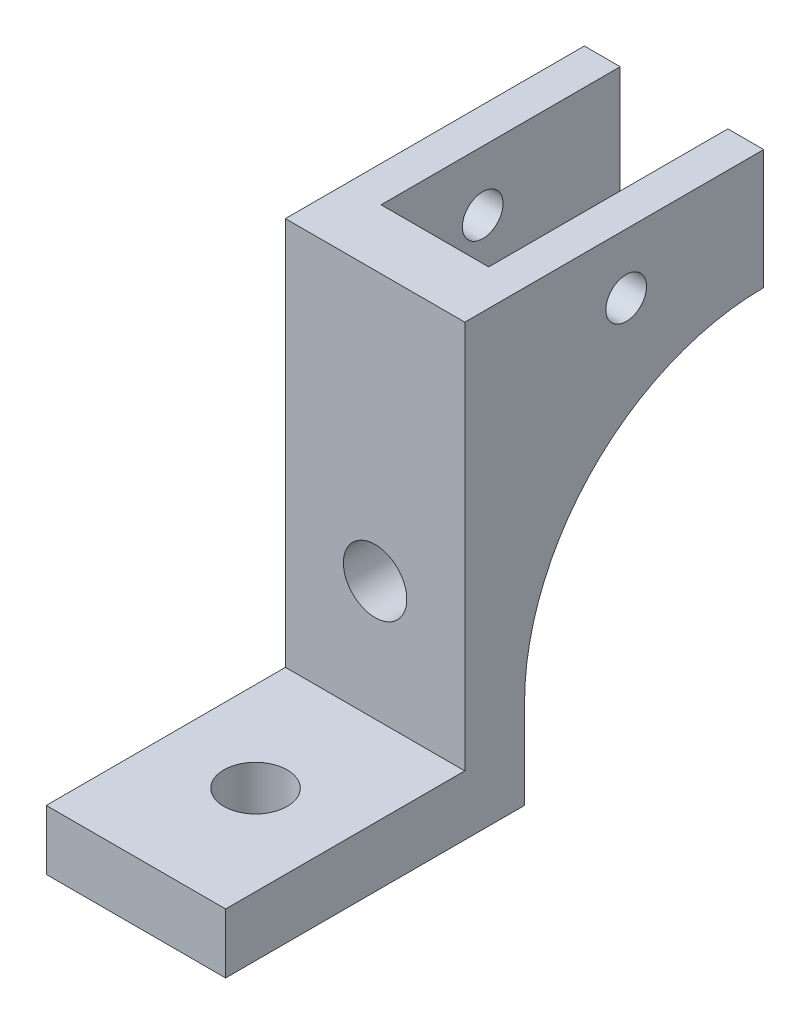
from build123d import *

# Parameters (mm, degrees)
SKETCH2_W               = 15
SKETCH2_H               = 37.5
BOSS_EXTRUDE1_DEPTH     = 5
SKETCH3_W               = 15
SKETCH3_H               = 5
BOSS_EXTRUDE2_DEPTH     = 20
SKETCH4_W               = 3
SKETCH4_H               = 10
BOSS_EXTRUDE3_DEPTH     = 20
CUT_EXTRUDE1_DEPTH      = 48.5
CUT_EXTRUDE1_DEPTH_BACK = 48.5
SKETCH5_R               = 1.7
FILLET1_R               = 20
SKETCH6_R               = 2.65
CUT_EXTRUDE2_DEPTH      = 10
SKETCH7_R               = 2.65
CUT_EXTRUDE3_DEPTH      = 10


with BuildPart() as part:
    # Sketch2 → Boss-Extrude1 (new body)
    with BuildSketch(Plane.XY):
        with Locations((7.5, 18.75)):
            Rectangle(SKETCH2_W, SKETCH2_H)
    extrude(amount=BOSS_EXTRUDE1_DEPTH)

    # Sketch3 → Boss-Extrude2 (add)
    with BuildSketch(Plane.XY.offset(5)):
        with Locations((7.5, 2.5)):
            Rectangle(SKETCH3_W, SKETCH3_H)
    extrude(amount=BOSS_EXTRUDE2_DEPTH)

    # Sketch4 → Boss-Extrude3 (add)
    with BuildSketch(Plane(origin=(0, 0, 0), x_dir=(-1, 0, 0), z_dir=(0, 0, -1))):
        with Locations((-13.5, 32.5)):
            Rectangle(SKETCH4_W, SKETCH4_H)
        with Locations((-1.5, 32.5)):
            Rectangle(SKETCH4_W, SKETCH4_H)
    extrude(amount=BOSS_EXTRUDE3_DEPTH)

    # Sketch5 → Cut-Extrude1 (cut, two sides: drawn at the far end of the back side and taken through both)
    with BuildSketch(Plane(origin=(15, 0, 0), x_dir=(0, 0, -1), z_dir=(1, 0, 0)).offset(-CUT_EXTRUDE1_DEPTH_BACK)):
        with Locations(Location((8.5, 32.5, 0), (0, 0, 90))):
            Circle(SKETCH5_R)
    extrude(amount=CUT_EXTRUDE1_DEPTH + CUT_EXTRUDE1_DEPTH_BACK, mode=Mode.SUBTRACT)

    # Fillet1
    fillet1_edges = [part.edges().sort_by_distance(p)[0] for p in [
        (1.5, 27.5, 0),
        (13.5, 27.5, 0),
    ]]
    fillet(fillet1_edges, radius=FILLET1_R - 0.0001)  # a hair under: the kernel refuses the full size

    # Sketch6 → Cut-Extrude2 (cut)
    with BuildSketch(Plane.XZ):
        with Locations(Location((7.5, 15, 0), (0, 0, 270))):
            Circle(SKETCH6_R)
    extrude(amount=-CUT_EXTRUDE2_DEPTH, mode=Mode.SUBTRACT)

    # Sketch7 → Cut-Extrude3 (cut)
    with BuildSketch(Plane(origin=(0, 0, 0), x_dir=(-1, 0, 0), z_dir=(0, 0, -1))):
        with Locations((-7.5, 15)):
            Circle(SKETCH7_R)
    extrude(amount=-CUT_EXTRUDE3_DEPTH, mode=Mode.SUBTRACT)


solid = part.part
